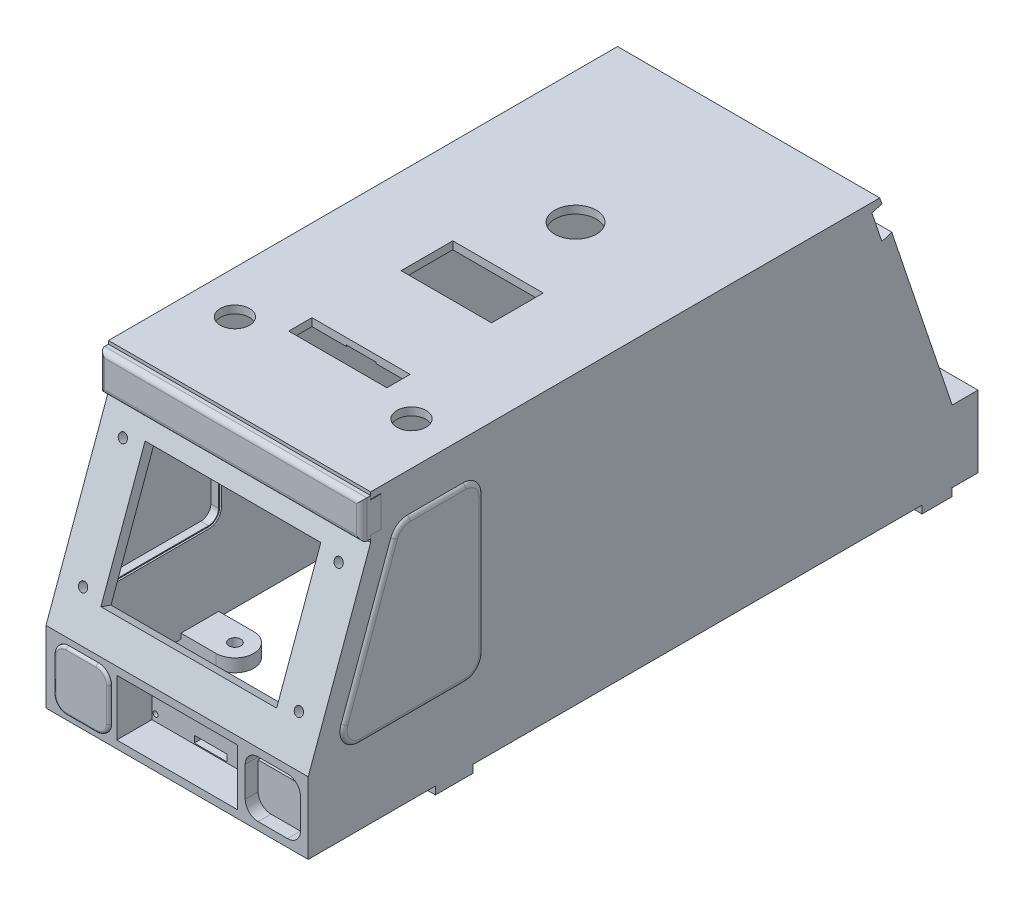
from build123d import *

# Parameters (mm, degrees)
SKETCH1_W                           = 46.7
SKETCH1_H                           = 21.7
HC_SR04_BASE_DEPTH                  = 3
SKETCH3_W                           = 52.7
SKETCH3_H                           = 27.7
SKETCH3_W_2                         = 46.7
SKETCH3_H_2                         = 21.7
HC_SR04_CONFINEMENT_DEPTH           = 16.6
SKETCH4_R                           = 0.99
SKETCH4_W                           = 12.7
SKETCH4_H                           = 2.6
HC_SR04_HOLES_DEPTH                 = 33.727740527
SKETCH5_W                           = 24.3848
SKETCH5_H                           = 27.7
HEAD_LIGHTS_BASE_DEPTH              = 3
HEAD_LIGHTS_CONFINEMENT_DEPTH       = 16.6
LCD_PANEL_BASE_DEPTH                = 101.4696
SKETCH10_W                          = 88.5
SKETCH10_H                          = 50
LCD_PANEL_RESTING_DEPTH             = 11.418897505
SKETCH11_W                          = 68
SKETCH11_H                          = 50
LCD_PANEL_VISION_DEPTH              = 98.319166783
SKETCH12_R                          = 1.7
LCD_PANEL_HOLES_DEPTH               = 98.319166783
LOGITECH_CAM_BASE_DEPTH             = 101.4696
LIDAR_BASE_DEPTH                    = 101.4696
SKETCH16_W                          = 12.5
SKETCH16_H                          = 33
SERVO_FITING_HOLE_DEPTH             = 38.48513716
SKETCH17_W                          = 12.5
SKETCH17_H                          = 22.8
SERVO_HEAD_HOLE_DEPTH               = 142.337998003
SKETCH19_R                          = 1.2
SERVO_HOLES_DEPTH                   = 142.337998003
SKETCH20_W                          = 12.5
SKETCH20_H                          = 5.1
SERVO_HOLES_DISTANCEREDUCTION_DEPTH = 3.85
SKETCH21_W                          = 91.4696
SKETCH21_H                          = 35
SERVO_ACCESS_HOLE_DEPTH             = 38.48513716
COCKPIT_BACK_DEPTH                  = 101.4696
COCKPIT_BACK_SHELL_START            = -47.7348
COCKPIT_BACK_SHELL_DEPTH            = 95.4696
SKETCH23_W                          = 93.4696
SKETCH23_H                          = 3
FRONT_BACK_MERGE_DEPTH              = 19.33513716
TRIM_REACH                          = 276.211
SKETCH24_W                          = 34.4848
SKETCH24_H                          = 45
SKETCH26_W                          = 29.4848
SKETCH26_H                          = 35
ADDITION_FROM_TRIM_DEPTH            = 3
SERVO_TRIM_REACH                    = 191.071
SKETCH27_W                          = 22.5
SKETCH27_H                          = 16.15
COCKPIT_SIDE_CLOSING_START          = -27.7
SKETCH30_W                          = 3
SKETCH30_H                          = 249.173140438
SKETCH30_W_2                        = 5
COCKPIT_SIDE_CLOSING_DEPTH          = 27.7
COCKPIT_SIDE_CLOSING_RIGHT_DEPTH    = 5
COCKPIT_SIDE_CLOSING_LEFT_DEPTH     = 5
COCKPIT_HOLES_DEPTH                 = 2
COCKPIT_HOLES_DEPTH_BACK            = 3
SKETCH44_R                          = 2.3
COCKPIT_HOLES_FILLING_DEPTH         = 10
SCREW_INSERTS_REACH                 = 274.833
SKETCH45_R                          = 2.3
SKETCH45_R_2                        = 5.65
SKETCH48_R                          = 2.3
SCREW_BACK_HOLES_DEPTH              = 5
SKETCH52_W                          = 21.3848
SKETCH52_H                          = 21.7
SKETCH52_W_2                        = 19.3848
BACKLIGHTS_BASE_DEPTH               = 5
BACKLIGHT_HOLES_REACH               = 293.021
SKETCH53_R                          = 6.15
SKETCH53_W                          = 21.3848
SKETCH53_H                          = 6
SKETCH53_W_2                        = 19.3848
FRONTLIGHTS_HOLE_REACH              = 280.978
SKETCH50_W                          = 15.3848
SKETCH50_H                          = 15.7
SKETCH50_W_2                        = 13.3848
MASSREDUCTION1_START                = -19.335137
SKETCH55_W                          = 91.4696
SKETCH55_H                          = 35.341831122
MASSREDUCTION1_DEPTH                = 19.335137
SKETCH61_W                          = 101.4696
SKETCH61_H                          = 12
FRONT_LED_RACK_DEPTH                = 4
SKETCH62_W                          = 101.4696
SKETCH62_H                          = 12
BACK_LED_RACK_DEPTH                 = 4
SKETCH63_W                          = 95.4696
SKETCH63_H                          = 0.342761735
BACK_FILLING1_DEPTH                 = 4.1098593
BACK_FILLING2_REACH                 = 275.965
SKETCH64_W                          = 95.4696
SKETCH64_H                          = 4.1098593
SKETCH68_W                          = 91.4696
SKETCH68_H                          = 65
CUT_EXTRUDE16_DEPTH                 = 11.418897505
CUT_EXTRUDE17_START                 = -45.7348
CUT_EXTRUDE17_DEPTH                 = 91.4696
SKETCH71_W                          = 21.3848
SKETCH71_H                          = 21.7
SKETCH71_W_2                        = 19.3848
BOSS_EXTRUDE2_DEPTH                 = 16.6
CUT_EXTRUDE18_REACH                 = 268.24
SKETCH72_W                          = 11.4696
SKETCH72_H                          = 12
SKETCH81_W                          = 11.1
SKETCH81_H                          = 11.1
BOSS_EXTRUDE5_DEPTH                 = 5
CUT_EXTRUDE21_DEPTH                 = 290.976855848
CUT_EXTRUDE22_DEPTH                 = 2
CUT_EXTRUDE23_DEPTH                 = 2
CUT_EXTRUDE24_REACH                 = 274.833
SKETCH87_W                          = 38
SKETCH87_H                          = 9
CUT_EXTRUDE25_REACH                 = 233.566
SKETCH88_W                          = 54.953192282
SKETCH88_H                          = 25.509171177
BOSS_EXTRUDE6_REACH                 = 271.795
SKETCH89_W                          = 35
SKETCH89_H                          = 3
CUT_EXTRUDE26_REACH                 = 274.833
SKETCH90_W                          = 35
SKETCH90_H                          = 20
CUT_EXTRUDE27_REACH                 = 274.833
SKETCH91_R                          = 8.07
SKETCH92_W                          = 21.3848
SKETCH92_H                          = 21.7
SKETCH92_W_2                        = 19.3848
CUT_EXTRUDE28_DEPTH                 = 5
CUT_EXTRUDE29_REACH                 = 283.434
SKETCH93_W                          = 21.3848
SKETCH93_H                          = 6
SKETCH93_W_2                        = 19.3848
FILLET1_R                           = 5
BOSS_EXTRUDE7_REACH                 = 267.977
SKETCH94_W                          = 95.4696
SKETCH94_H                          = 3.1098593
CUT_EXTRUDE31_START                 = -5.7348
CUT_EXTRUDE31_DEPTH                 = 11.4696
FILLET2_R                           = 5
BOSS_EXTRUDE8_DEPTH                 = 1
SKETCH98_W                          = 21.5
SKETCH98_H                          = 23
BOSS_EXTRUDE9_DEPTH                 = 1
SHELL5_START                        = 15.6
SHELL5_DEPTH                        = 1.5
FILLET3_R                           = 5
FILLET4_R                           = 1
BOSS_EXTRUDE10_DEPTH                = 101.4696
SKETCH102_W                         = 97.4696
SKETCH102_H                         = 11.8
CUT_EXTRUDE32_DEPTH                 = 7
FILLET5_R                           = 2
BOSS_EXTRUDE11_DEPTH                = 3
BOSS_EXTRUDE12_DEPTH                = 1
FILLET6_R                           = 2
FILLET11_R                          = 1


with BuildPart() as part:
    # Sketch1 → HC-SR04_Base (new body)
    with BuildSketch(Plane.XY):
        Rectangle(SKETCH1_W, SKETCH1_H)
    extrude(amount=HC_SR04_BASE_DEPTH)

    # Sketch3 → HC-SR04_Confinement (add)
    with BuildSketch(Plane(origin=(0, 0, 0), x_dir=(-1, 0, 0), z_dir=(0, 0, -1))):
        Rectangle(SKETCH3_W, SKETCH3_H)
        Rectangle(SKETCH3_W_2, SKETCH3_H_2, mode=Mode.SUBTRACT)
    extrude(amount=-HC_SR04_CONFINEMENT_DEPTH)

    # Sketch4 → HC-SR04_Holes (cut, through all)
    with BuildSketch(Plane.XY.offset(3)):
        with Locations((-21.95, 9.45)):
            Circle(SKETCH4_R)
        with Locations((-21.95, -8.25)):
            Circle(SKETCH4_R)
        with Locations((20.75, -8.25)):
            Circle(SKETCH4_R)
        with Locations((20.75, 9.45)):
            Circle(SKETCH4_R)
        with Locations((-0.6, -9.15)):
            Rectangle(SKETCH4_W, SKETCH4_H)
    extrude(amount=-HC_SR04_HOLES_DEPTH, mode=Mode.SUBTRACT)

    # Sketch5 → Head-lights_Base (add)
    with BuildSketch(Plane.XY):
        with Locations((-38.5424, 0)):
            Rectangle(SKETCH5_W, SKETCH5_H)
        with Locations((38.5424, 0)):
            Rectangle(SKETCH5_W, SKETCH5_H)
    extrude(amount=HEAD_LIGHTS_BASE_DEPTH)

    # Sketch7 → Head-lights_Confinement (add)
    with BuildSketch(Plane(origin=(0, 0, 0), x_dir=(-1, 0, 0), z_dir=(0, 0, -1))):
        Polygon((26.35, -13.85), (26.35, -10.85), (29.35, -10.85), (47.7348, -10.85), (47.7348, 10.85), (29.35, 10.85), (26.35, 10.85), (26.35, 13.85), (50.7348, 13.85), (50.7348, -13.85), align=None)
        Polygon((-50.7348, -13.85), (-50.7348, 13.85), (-26.35, 13.85), (-26.35, 10.85), (-29.35, 10.85), (-47.7348, 10.85), (-47.7348, -10.85), (-29.35, -10.85), (-26.35, -10.85), (-26.35, -13.85), align=None)
    extrude(amount=-HEAD_LIGHTS_CONFINEMENT_DEPTH)

    # Sketch8 → LCD-Panel_Base (add)
    with BuildSketch(Plane(origin=(50.7348, 0, 0), x_dir=(0, 0, -1), z_dir=(1, 0, 0))):
        Polygon((-16.6, 13.85), (0, 13.85), (22.231309316, 74.930020351), (7.573140438, 80.265157511), align=None)
    extrude(amount=-LCD_PANEL_BASE_DEPTH)

    # Sketch10 → LCD-Panel_Resting (cut)
    with BuildSketch(Plane(origin=(0, 1.620142231, 4.451304197), x_dir=(-1, 0, 0), z_dir=(0, -0.3420201433256657, -0.9396926207859095))):
        with Locations((0, 45.514742798)):
            Rectangle(SKETCH10_W, SKETCH10_H)
    extrude(amount=-LCD_PANEL_RESTING_DEPTH, mode=Mode.SUBTRACT)

    # Sketch11 → LCD-Panel_Vision (cut, through all)
    with BuildSketch(Plane(origin=(0, 1.620142231, 4.451304197), x_dir=(-1, 0, 0), z_dir=(0, -0.3420201433256657, -0.9396926207859095))):
        with Locations((0, 45.514742798)):
            Rectangle(SKETCH11_W, SKETCH11_H)
    extrude(amount=-LCD_PANEL_VISION_DEPTH, mode=Mode.SUBTRACT)

    # Sketch12 → LCD-Panel_Holes (cut, through all)
    with BuildSketch(Plane(origin=(0, 1.620142231, 4.451304197), x_dir=(-1, 0, 0), z_dir=(0, -0.3420201433256657, -0.9396926207859095))):
        with Locations(Location((-41.75, 23.014742798, 0), (0, 0, 90))):
            Circle(SKETCH12_R)
        with Locations(Location((-41.75, 68.014742798, 0), (0, 0, 90))):
            Circle(SKETCH12_R)
        with Locations(Location((41.75, 68.014742798, 0), (0, 0, 90))):
            Circle(SKETCH12_R)
        with Locations(Location((41.75, 23.014742798, 0), (0, 0, 90))):
            Circle(SKETCH12_R)
    extrude(amount=-LCD_PANEL_HOLES_DEPTH, mode=Mode.SUBTRACT)

    # Sketch13 → Logitech-Cam_Base (add)
    with BuildSketch(Plane(origin=(50.7348, 0, 0), x_dir=(0, 0, -1), z_dir=(1, 0, 0))):
        Polygon((22.231309316, 74.930020351), (52.573140438, 74.930020351), (52.573140438, 80.265157511), (52.573140438, 97.265157511), (7.573140438, 97.265157511), (7.573140438, 80.265157511), align=None)
    extrude(amount=-LOGITECH_CAM_BASE_DEPTH)

    # Sketch15 → Lidar_Base (add)
    with BuildSketch(Plane(origin=(50.7348, 0, 0), x_dir=(0, 0, -1), z_dir=(1, 0, 0))):
        Polygon((52.573140438, 97.265157511), (52.573140438, 122.265157511), (97.573140438, 122.265157511), (97.573140438, 74.930020351), (52.573140438, 74.930020351), align=None)
    extrude(amount=-LIDAR_BASE_DEPTH)

    # Sketch16 → Servo_Fiting_Hole (cut)
    with BuildSketch(Plane.XZ.offset(-74.930020351)):
        with Locations((0, -75.073140438)):
            Rectangle(SKETCH16_W, SKETCH16_H)
    extrude(amount=-SERVO_FITING_HOLE_DEPTH, mode=Mode.SUBTRACT)

    # Sketch17 → Servo_Head_Hole (cut, through all)
    with BuildSketch(Plane.XZ.offset(-74.930020351)):
        with Locations((0, -75.073140438)):
            Rectangle(SKETCH17_W, SKETCH17_H)
    extrude(amount=-SERVO_HEAD_HOLE_DEPTH, mode=Mode.SUBTRACT)

    # Sketch19 → Servo_Holes (cut, through all)
    with BuildSketch(Plane.XZ.offset(-74.930020351)):
        with Locations(Location((0, -60.923140438, 0), (0, 0, 270))):
            Circle(SKETCH19_R)
        with Locations(Location((0, -89.223140438, 0), (0, 0, 270))):
            Circle(SKETCH19_R)
    extrude(amount=-SERVO_HOLES_DEPTH, mode=Mode.SUBTRACT)

    # Sketch20 → Servo_Holes_DistanceReduction (cut)
    with BuildSketch(Plane(origin=(0, 122.265157511, 0), x_dir=(1, 0, 0), z_dir=(0, 1, 0))):
        with Locations((0, 61.123140438)):
            Rectangle(SKETCH20_W, SKETCH20_H)
        with Locations((0, 89.023140438)):
            Rectangle(SKETCH20_W, SKETCH20_H)
    extrude(amount=-SERVO_HOLES_DISTANCEREDUCTION_DEPTH, mode=Mode.SUBTRACT)

    # Sketch21 → Servo_Access_Hole (cut)
    with BuildSketch(Plane.XZ.offset(-74.930020351)):
        with Locations((0, -75.073140438)):
            Rectangle(SKETCH21_W, SKETCH21_H)
    extrude(amount=-SERVO_ACCESS_HOLE_DEPTH, mode=Mode.SUBTRACT)

    # Sketch22 → Cockpit-Back (add)
    with BuildSketch(Plane(origin=(50.7348, 0, 0), x_dir=(0, 0, -1), z_dir=(1, 0, 0))):
        Polygon((97.573140438, 97.265157511), (204.562849888, 97.265157511), (232.573140438, 13.85), (232.573140438, -13.85), (225.073140438, -13.85), (225.073140438, 13.85), (204.562849888, 74.930020351), (97.573140438, 74.930020351), align=None)
    extrude(amount=-COCKPIT_BACK_DEPTH)

    # Cockpit-Back-Shell: read off the stored shape, not the designer's step
    # Cockpit-Back-Shell outline → Cockpit-Back-Shell (cut)
    with BuildSketch(Plane.YZ.offset(COCKPIT_BACK_SHELL_START)):
        Polygon((14.340240139, -228.073140438), (-10.85, -228.073140438), (-10.85, -229.573140438), (13.359759861, -229.573140438), (94.265157511, -202.405611624), (94.265157511, -95.573140438), (74.930020351, -95.573140438), (74.930020351, -207.727469475), align=None)
    extrude(amount=COCKPIT_BACK_SHELL_DEPTH, mode=Mode.SUBTRACT)

    # Sketch23 → Front-Back-Merge (cut)
    with BuildSketch(Plane.XZ.offset(-74.930020351)):
        with Locations((1, -94.073140438)):
            Rectangle(SKETCH23_W, SKETCH23_H)
    extrude(amount=-FRONT_BACK_MERGE_DEPTH, mode=Mode.SUBTRACT)

    # Trim: up to this face of the body (flat: up to its plane)
    trim_end = Plane(part.part.faces().sort_by_distance((0, 97.265157511, -30.073140438))[0])
    # Sketch24 → Trim (cut, up to the picked face)
    with BuildSketch(Plane(origin=(0, 122.265157511, 0), x_dir=(1, 0, 0), z_dir=(0, 1, 0)), mode=Mode.PRIVATE) as trim_sk1:
        with Locations((33.4924, 75.073140438)):
            Rectangle(SKETCH24_W, SKETCH24_H)
    trim_tool1 = split(extrude(trim_sk1.sketch, amount=-TRIM_REACH, mode=Mode.PRIVATE), bisect_by=trim_end, keep=Keep.BOTH, mode=Mode.PRIVATE)
    # Sketch24 → Trim (cut, up to the picked face)
    with BuildSketch(Plane(origin=(0, 122.265157511, 0), x_dir=(1, 0, 0), z_dir=(0, 1, 0)), mode=Mode.PRIVATE) as trim_sk2:
        with Locations((-33.4924, 75.073140438)):
            Rectangle(SKETCH24_W, SKETCH24_H)
    trim_tool2 = split(extrude(trim_sk2.sketch, amount=-TRIM_REACH, mode=Mode.PRIVATE), bisect_by=trim_end, keep=Keep.BOTH, mode=Mode.PRIVATE)
    add(trim_tool1.solids().sort_by(Axis((33.4924, 122.265158, -75.07314), (0, -1, 0)))[0], mode=Mode.SUBTRACT)
    add(trim_tool2.solids().sort_by(Axis((-33.4924, 122.265158, -75.07314), (0, -1, 0)))[0], mode=Mode.SUBTRACT)

    # Sketch26 → Addition-From-Trim (add)
    with BuildSketch(Plane.XZ.offset(-94.265157511)):
        with Locations((-30.9924, -75.073140438)):
            Rectangle(SKETCH26_W, SKETCH26_H)
        with Locations((30.9924, -75.073140438)):
            Rectangle(SKETCH26_W, SKETCH26_H)
    extrude(amount=-ADDITION_FROM_TRIM_DEPTH)

    # Servo-Trim: up to this face of the body (flat: up to its plane)
    servo_trim_end = Plane(part.part.faces().sort_by_distance((0, 109.765157511, -52.573140438))[0])
    # Sketch27 → Servo-Trim (cut, up to the picked face)
    with BuildSketch(Plane(origin=(0, 0, -97.573140438), x_dir=(-1, 0, 0), z_dir=(0, 0, -1)), mode=Mode.PRIVATE) as servo_trim_sk1:
        with Locations((0, 105.340157511)):
            Rectangle(SKETCH27_W, SKETCH27_H)
    servo_trim_tool1 = split(extrude(servo_trim_sk1.sketch, amount=-SERVO_TRIM_REACH, mode=Mode.PRIVATE), bisect_by=servo_trim_end, keep=Keep.BOTH, mode=Mode.PRIVATE)
    add(servo_trim_tool1.solids().sort_by(Axis((0, 105.340158, -97.57314), (0, 0, 1)))[0], mode=Mode.SUBTRACT)

    # Sketch30 → Cockpit-Side-Closing (add)
    with BuildSketch(Plane.XZ.offset(13.85).offset(COCKPIT_SIDE_CLOSING_START)):
        with Locations((49.2348, -107.986570219)):
            Rectangle(SKETCH30_W, SKETCH30_H)
        with Locations((-48.2348, -107.986570219)):
            Rectangle(SKETCH30_W_2, SKETCH30_H)
    extrude(amount=COCKPIT_SIDE_CLOSING_DEPTH)

    # Sketch31 → Cockpit-Side-Closing-Right (add)
    with BuildSketch(Plane(origin=(50.7348, 0, 0), x_dir=(0, 0, -1), z_dir=(1, 0, 0))):
        Polygon((225.073140438, 13.85), (0, 13.85), (22.231309316, 74.930020351), (204.562849888, 74.930020351), align=None)
    extrude(amount=-COCKPIT_SIDE_CLOSING_RIGHT_DEPTH)

    # Sketch32 → Cockpit-Side-Closing-Left (add)
    with BuildSketch(Plane.ZY.offset(50.7348)):
        Polygon((0, 13.85), (-225.073140438, 13.85), (-204.562849888, 74.930020351), (-22.231309316, 74.930020351), align=None)
    extrude(amount=-COCKPIT_SIDE_CLOSING_LEFT_DEPTH)

    # Sketch44 → Cockpit_Holes (add, two sides: drawn at the far end of the back side and taken through both)
    # profile 1 of 4: a face of its own
    with BuildSketch(Plane(origin=(0, -13.85, 0), x_dir=(1, 0, 0), z_dir=(0, 1, 0)).offset(-COCKPIT_HOLES_DEPTH_BACK)):
        with BuildLine():
            Line((-34.1648, 47.223140438), (-50.7348, 47.223140438))
            Line((-50.7348, 47.223140438), (-50.7348, 32.623140438))
            Line((-50.7348, 32.623140438), (-34.1648, 32.623140438))
            ThreePointArc((-34.1648, 32.623140438), (-26.8648, 39.923140438), (-34.1648, 47.223140438))
        make_face()
        with Locations(Location((-34.1648, 39.923140438, 0), (0, 0, 270))):
            Circle(SKETCH44_R, mode=Mode.SUBTRACT)
    # profile 2 of 4: a face of its own
    with BuildSketch(Plane(origin=(0, -13.85, 0), x_dir=(1, 0, 0), z_dir=(0, 1, 0)).offset(-COCKPIT_HOLES_DEPTH_BACK)):
        with BuildLine():
            Line((34.1648, 47.223140438), (50.7348, 47.223140438))
            Line((50.7348, 47.223140438), (50.7348, 32.623140438))
            Line((50.7348, 32.623140438), (34.1648, 32.623140438))
            ThreePointArc((34.1648, 32.623140438), (26.8648, 39.923140438), (34.1648, 47.223140438))
        make_face()
        with Locations(Location((34.1648, 39.923140438, 0), (0, 0, 270))):
            Circle(SKETCH44_R, mode=Mode.SUBTRACT)
    # profile 3 of 4: a face of its own
    with BuildSketch(Plane(origin=(0, -13.85, 0), x_dir=(1, 0, 0), z_dir=(0, 1, 0)).offset(-COCKPIT_HOLES_DEPTH_BACK)):
        with BuildLine():
            Line((-31.3848, 220.933140438), (-50.7348, 220.933140438))
            Line((-50.7348, 220.933140438), (-50.7348, 232.573140438))
            Line((-50.7348, 232.573140438), (-31.3848, 232.573140438))
            ThreePointArc((-31.3848, 232.573140438), (-25.5648, 226.753140438), (-31.3848, 220.933140438))
        make_face()
        with Locations(Location((-31.3848, 226.753140438, 0), (0, 0, 270))):
            Circle(SKETCH44_R, mode=Mode.SUBTRACT)
    # profile 4 of 4: a face of its own
    with BuildSketch(Plane(origin=(0, -13.85, 0), x_dir=(1, 0, 0), z_dir=(0, 1, 0)).offset(-COCKPIT_HOLES_DEPTH_BACK)):
        with BuildLine():
            Line((31.3952, 232.573140438), (50.7348, 232.573140438))
            Line((50.7348, 232.573140438), (50.7348, 220.933140438))
            Line((50.7348, 220.933140438), (31.3952, 220.933140438))
            ThreePointArc((31.3952, 220.933140438), (25.5752, 226.753140438), (31.3952, 232.573140438))
        make_face()
        with Locations(Location((31.3952, 226.753140438, 0), (0, 0, 270))):
            Circle(SKETCH44_R, mode=Mode.SUBTRACT)
    extrude(amount=COCKPIT_HOLES_DEPTH + COCKPIT_HOLES_DEPTH_BACK)

    # Sketch47 → Cockpit-Holes-Filling (add)
    with BuildSketch(Plane(origin=(0, 0, -232.573140438), x_dir=(-1, 0, 0), z_dir=(0, 0, -1))):
        Polygon((-50.7348, 13.85), (-15.7348, 13.85), (15.7348, 13.85), (50.7348, 13.85), (50.7348, -13.85), (15.7348, -13.85), (-15.7348, -13.85), (-50.7348, -13.85), align=None)
    extrude(amount=COCKPIT_HOLES_FILLING_DEPTH)

    # Screw -Inserts: up to this face of the body (flat: up to its plane)
    screw_inserts_end = Plane(part.part.faces().sort_by_distance((38.255559, -11.85, -39.923140438))[0])
    # Sketch45 → Screw -Inserts (cut, up to the picked face)
    with BuildSketch(Plane(origin=(0, 97.265157511, 0), x_dir=(1, 0, 0), z_dir=(0, 1, 0)), mode=Mode.PRIVATE) as screw_inserts_sk1:
        with Locations(Location((31.3952, 226.753140438, 0), (0, 0, 270))):
            Circle(SKETCH45_R)
    screw_inserts_tool1 = split(extrude(screw_inserts_sk1.sketch, amount=-SCREW_INSERTS_REACH, mode=Mode.PRIVATE), bisect_by=screw_inserts_end, keep=Keep.BOTH, mode=Mode.PRIVATE)
    # Sketch45 → Screw -Inserts (cut, up to the picked face)
    with BuildSketch(Plane(origin=(0, 97.265157511, 0), x_dir=(1, 0, 0), z_dir=(0, 1, 0)), mode=Mode.PRIVATE) as screw_inserts_sk2:
        with Locations(Location((-34.1648, 39.923140438, 0), (0, 0, 270))):
            Circle(SKETCH45_R)
    screw_inserts_tool2 = split(extrude(screw_inserts_sk2.sketch, amount=-SCREW_INSERTS_REACH, mode=Mode.PRIVATE), bisect_by=screw_inserts_end, keep=Keep.BOTH, mode=Mode.PRIVATE)
    # Sketch45 → Screw -Inserts (cut, up to the picked face)
    with BuildSketch(Plane(origin=(0, 97.265157511, 0), x_dir=(1, 0, 0), z_dir=(0, 1, 0)), mode=Mode.PRIVATE) as screw_inserts_sk3:
        with Locations(Location((34.1648, 39.923140438, 0), (0, 0, 270))):
            Circle(SKETCH45_R)
    screw_inserts_tool3 = split(extrude(screw_inserts_sk3.sketch, amount=-SCREW_INSERTS_REACH, mode=Mode.PRIVATE), bisect_by=screw_inserts_end, keep=Keep.BOTH, mode=Mode.PRIVATE)
    # Sketch45 → Screw -Inserts (cut, up to the picked face)
    with BuildSketch(Plane(origin=(0, 97.265157511, 0), x_dir=(1, 0, 0), z_dir=(0, 1, 0)), mode=Mode.PRIVATE) as screw_inserts_sk4:
        with Locations(Location((-34.1648, 39.923140438, 0), (0, 0, 270))):
            Circle(SKETCH45_R_2)
    screw_inserts_tool4 = split(extrude(screw_inserts_sk4.sketch, amount=-SCREW_INSERTS_REACH, mode=Mode.PRIVATE), bisect_by=screw_inserts_end, keep=Keep.BOTH, mode=Mode.PRIVATE)
    # Sketch45 → Screw -Inserts (cut, up to the picked face)
    with BuildSketch(Plane(origin=(0, 97.265157511, 0), x_dir=(1, 0, 0), z_dir=(0, 1, 0)), mode=Mode.PRIVATE) as screw_inserts_sk5:
        with Locations(Location((34.1648, 39.923140438, 0), (0, 0, 270))):
            Circle(SKETCH45_R_2)
    screw_inserts_tool5 = split(extrude(screw_inserts_sk5.sketch, amount=-SCREW_INSERTS_REACH, mode=Mode.PRIVATE), bisect_by=screw_inserts_end, keep=Keep.BOTH, mode=Mode.PRIVATE)
    # Sketch45 → Screw -Inserts (cut, up to the picked face)
    with BuildSketch(Plane(origin=(0, 97.265157511, 0), x_dir=(1, 0, 0), z_dir=(0, 1, 0)), mode=Mode.PRIVATE) as screw_inserts_sk6:
        with Locations(Location((-31.3848, 226.753140438, 0), (0, 0, 270))):
            Circle(SKETCH45_R_2)
    screw_inserts_tool6 = split(extrude(screw_inserts_sk6.sketch, amount=-SCREW_INSERTS_REACH, mode=Mode.PRIVATE), bisect_by=screw_inserts_end, keep=Keep.BOTH, mode=Mode.PRIVATE)
    # Sketch45 → Screw -Inserts (cut, up to the picked face)
    with BuildSketch(Plane(origin=(0, 97.265157511, 0), x_dir=(1, 0, 0), z_dir=(0, 1, 0)), mode=Mode.PRIVATE) as screw_inserts_sk7:
        with Locations(Location((31.3952, 226.753140438, 0), (0, 0, 270))):
            Circle(SKETCH45_R_2)
    screw_inserts_tool7 = split(extrude(screw_inserts_sk7.sketch, amount=-SCREW_INSERTS_REACH, mode=Mode.PRIVATE), bisect_by=screw_inserts_end, keep=Keep.BOTH, mode=Mode.PRIVATE)
    # Sketch45 → Screw -Inserts (cut, up to the picked face)
    with BuildSketch(Plane(origin=(0, 97.265157511, 0), x_dir=(1, 0, 0), z_dir=(0, 1, 0)), mode=Mode.PRIVATE) as screw_inserts_sk8:
        with Locations(Location((-31.3848, 226.753140438, 0), (0, 0, 270))):
            Circle(SKETCH45_R)
    screw_inserts_tool8 = split(extrude(screw_inserts_sk8.sketch, amount=-SCREW_INSERTS_REACH, mode=Mode.PRIVATE), bisect_by=screw_inserts_end, keep=Keep.BOTH, mode=Mode.PRIVATE)
    add(screw_inserts_tool1.solids().sort_by(Axis((31.3952, 97.265158, -226.75314), (0, -1, 0)))[0], mode=Mode.SUBTRACT)
    add(screw_inserts_tool2.solids().sort_by(Axis((-34.1648, 97.265158, -39.92314), (0, -1, 0)))[0], mode=Mode.SUBTRACT)
    add(screw_inserts_tool3.solids().sort_by(Axis((34.1648, 97.265158, -39.92314), (0, -1, 0)))[0], mode=Mode.SUBTRACT)
    add(screw_inserts_tool4.solids().sort_by(Axis((-34.1648, 97.265158, -39.92314), (0, -1, 0)))[0], mode=Mode.SUBTRACT)
    add(screw_inserts_tool5.solids().sort_by(Axis((34.1648, 97.265158, -39.92314), (0, -1, 0)))[0], mode=Mode.SUBTRACT)
    add(screw_inserts_tool6.solids().sort_by(Axis((-31.3848, 97.265158, -226.75314), (0, -1, 0)))[0], mode=Mode.SUBTRACT)
    add(screw_inserts_tool7.solids().sort_by(Axis((31.3952, 97.265158, -226.75314), (0, -1, 0)))[0], mode=Mode.SUBTRACT)
    add(screw_inserts_tool8.solids().sort_by(Axis((-31.3848, 97.265158, -226.75314), (0, -1, 0)))[0], mode=Mode.SUBTRACT)

    # Sketch48 → Screw-Back-Holes (cut)
    with BuildSketch(Plane.XZ.offset(16.85)):
        with Locations(Location((-31.3848, -226.753140438, 0), (0, 0, 90))):
            Circle(SKETCH48_R)
        with Locations(Location((31.3952, -226.753140438, 0), (0, 0, 90))):
            Circle(SKETCH48_R)
    extrude(amount=-SCREW_BACK_HOLES_DEPTH, mode=Mode.SUBTRACT)

    # Sketch52 → BackLights_Base (cut)
    with BuildSketch(Plane(origin=(0, 0, -242.573140438), x_dir=(-1, 0, 0), z_dir=(0, 0, -1))):
        with Locations((-37.0424, 0)):
            Rectangle(SKETCH52_W, SKETCH52_H)
        with Locations((36.0424, 0)):
            Rectangle(SKETCH52_W_2, SKETCH52_H)
    extrude(amount=-BACKLIGHTS_BASE_DEPTH, mode=Mode.SUBTRACT)

    # Sketch53 → BackLight_Holes (cut, up to next)
    with BuildSketch(Plane(origin=(0, 0, -242.573140438), x_dir=(-1, 0, 0), z_dir=(0, 0, -1)), mode=Mode.PRIVATE) as backlight_holes_sk1:
        Circle(SKETCH53_R)
    backlight_holes_tool1 = extrude(backlight_holes_sk1.sketch, amount=-BACKLIGHT_HOLES_REACH, mode=Mode.PRIVATE) & part.part
    # Sketch53 → BackLight_Holes (cut, up to next)
    with BuildSketch(Plane(origin=(0, 0, -242.573140438), x_dir=(-1, 0, 0), z_dir=(0, 0, -1)), mode=Mode.PRIVATE) as backlight_holes_sk2:
        with Locations((-37.0424, 7.85)):
            Rectangle(SKETCH53_W, SKETCH53_H)
    backlight_holes_tool2 = extrude(backlight_holes_sk2.sketch, amount=-BACKLIGHT_HOLES_REACH, mode=Mode.PRIVATE) & part.part
    # Sketch53 → BackLight_Holes (cut, up to next)
    with BuildSketch(Plane(origin=(0, 0, -242.573140438), x_dir=(-1, 0, 0), z_dir=(0, 0, -1)), mode=Mode.PRIVATE) as backlight_holes_sk3:
        with Locations((36.0424, 7.85)):
            Rectangle(SKETCH53_W_2, SKETCH53_H)
    backlight_holes_tool3 = extrude(backlight_holes_sk3.sketch, amount=-BACKLIGHT_HOLES_REACH, mode=Mode.PRIVATE) & part.part
    add(backlight_holes_tool1.solids().sort_by_distance((0, 0, -242.57314))[0], mode=Mode.SUBTRACT)
    add(backlight_holes_tool2.solids().sort_by_distance((37.0424, 7.85, -242.57314))[0], mode=Mode.SUBTRACT)
    add(backlight_holes_tool3.solids().sort_by_distance((-36.0424, 7.85, -242.57314))[0], mode=Mode.SUBTRACT)

    # Sketch50 → FrontLights_Hole (cut, up to next)
    with BuildSketch(Plane.XY.offset(3), mode=Mode.PRIVATE) as frontlights_hole_sk1:
        with Locations((37.0424, 0)):
            Rectangle(SKETCH50_W, SKETCH50_H)
    frontlights_hole_tool1 = extrude(frontlights_hole_sk1.sketch, amount=-FRONTLIGHTS_HOLE_REACH, mode=Mode.PRIVATE) & part.part
    # Sketch50 → FrontLights_Hole (cut, up to next)
    with BuildSketch(Plane.XY.offset(3), mode=Mode.PRIVATE) as frontlights_hole_sk2:
        with Locations((-36.0424, 0)):
            Rectangle(SKETCH50_W_2, SKETCH50_H)
    frontlights_hole_tool2 = extrude(frontlights_hole_sk2.sketch, amount=-FRONTLIGHTS_HOLE_REACH, mode=Mode.PRIVATE) & part.part
    add(frontlights_hole_tool1.solids().sort_by_distance((37.0424, 0, 3))[0], mode=Mode.SUBTRACT)
    add(frontlights_hole_tool2.solids().sort_by_distance((-36.0424, 0, 3))[0], mode=Mode.SUBTRACT)

    # Sketch55 → MassReduction1 (cut)
    with BuildSketch(Plane.XZ.offset(-74.930020351).offset(MASSREDUCTION1_START)):
        with Locations((0, -39.902224877)):
            Rectangle(SKETCH55_W, SKETCH55_H)
    extrude(amount=MASSREDUCTION1_DEPTH, mode=Mode.SUBTRACT)

    # Sketch61 → Front-LED-rack (cut)
    with BuildSketch(Plane.XY.offset(-7.573140438)):
        with Locations((0, 88.765157511)):
            Rectangle(SKETCH61_W, SKETCH61_H)
    extrude(amount=-FRONT_LED_RACK_DEPTH, mode=Mode.SUBTRACT)

    # Sketch62 → Back-LED-Rack (cut)
    with BuildSketch(Plane(origin=(0, 71.586402538, -213.185615933), x_dir=(-1, 0, 0), z_dir=(0, 0.3183261982820336, -0.9479812400503016))):
        with Locations((0, 18.587830317)):
            Rectangle(SKETCH62_W, SKETCH62_H)
    extrude(amount=-BACK_LED_RACK_DEPTH, mode=Mode.SUBTRACT)

    # Sketch63 → Back-Filling1 (add)
    with BuildSketch(Plane(origin=(0, 70.631423943, -210.341672213), x_dir=(1, 0, 0), z_dir=(0, -0.3183261982820336, 0.9479812400503016))):
        with Locations((0, 24.759211185)):
            Rectangle(SKETCH63_W, SKETCH63_H)
    extrude(amount=BACK_FILLING1_DEPTH)

    # Sketch64 → Back-Filling2 (add, up to next)
    with BuildSketch(Plane(origin=(0, 23.633733569, 7.936060589), x_dir=(1, 0, 0), z_dir=(0, 0.9479812400503016, 0.3183261982820337)), mode=Mode.PRIVATE) as back_filling2_sk1:
        with Locations((0, 219.828862271)):
            Rectangle(SKETCH64_W, SKETCH64_H)
    back_filling2_tool1 = extrude(back_filling2_sk1.sketch, amount=BACK_FILLING2_REACH, mode=Mode.PRIVATE) - part.part
    add(back_filling2_tool1.solids().sort_by_distance((0, 93.61102, -200.457577))[0])

    # Sketch68 → Cut-Extrude16 (cut)
    with BuildSketch(Plane(origin=(0, 1.620142231, 4.451304197), x_dir=(-1, 0, 0), z_dir=(0, -0.3420201433256658, -0.9396926207859095))):
        with Locations((0, 45.514742798)):
            Rectangle(SKETCH68_W, SKETCH68_H)
    extrude(amount=-CUT_EXTRUDE16_DEPTH, mode=Mode.SUBTRACT)

    # Cut-Extrude17: read off the stored shape, not the designer's step
    # Cut-Extrude17 outline → Cut-Extrude17 (cut)
    with BuildSketch(Plane.YZ.offset(CUT_EXTRUDE17_START)):
        Polygon((94.265157511, -22.231309316), (94.265157511, -17.116986807), (78.835513312, -11.501055593), (74.930020351, -22.231309316), align=None)
    extrude(amount=CUT_EXTRUDE17_DEPTH, mode=Mode.SUBTRACT)

    # Sketch71 → Boss-Extrude2 (add)
    with BuildSketch(Plane.XY.offset(16.6)):
        with Locations((37.0424, 0)):
            Rectangle(SKETCH71_W, SKETCH71_H)
        with Locations((-36.0424, 0)):
            Rectangle(SKETCH71_W_2, SKETCH71_H)
    extrude(amount=-BOSS_EXTRUDE2_DEPTH)

    # Sketch72 → Cut-Extrude18 (cut, up to next)
    with BuildSketch(Plane.XY.offset(-11.573140438), mode=Mode.PRIVATE) as cut_extrude18_sk1:
        with Locations((0, 88.765157511)):
            Rectangle(SKETCH72_W, SKETCH72_H)
    cut_extrude18_tool1 = extrude(cut_extrude18_sk1.sketch, amount=-CUT_EXTRUDE18_REACH, mode=Mode.PRIVATE) & part.part
    add(cut_extrude18_tool1.solids().sort_by_distance((0, 88.765158, -11.57314))[0], mode=Mode.SUBTRACT)

    # Sketch81 → Boss-Extrude5 (add)
    with BuildSketch(Plane(origin=(0, 97.265157511, 0), x_dir=(1, 0, 0), z_dir=(0, 1, 0))):
        with Locations((-21.8, 58.123140438)):
            Rectangle(SKETCH81_W, SKETCH81_H)
        with Locations((-21.8, 92.023140438)):
            Rectangle(SKETCH81_W, SKETCH81_H)
        with Locations((21.8, 92.023140438)):
            Rectangle(SKETCH81_W, SKETCH81_H)
        with Locations((21.8, 58.123140438)):
            Rectangle(SKETCH81_W, SKETCH81_H)
    extrude(amount=BOSS_EXTRUDE5_DEPTH)

    # Sketch33 → Cut-Extrude21 (cut, through all)
    with BuildSketch(Plane.ZY.offset(50.7348)):
        Polygon((-48.304538666, 17.710800741), (-48.304538666, 80.51138782), (-18.304538666, 80.51138782), (4.553005725, 17.710800741), align=None)
    extrude(amount=-CUT_EXTRUDE21_DEPTH, mode=Mode.SUBTRACT)

    # Sketch85 → Cut-Extrude22 (cut)
    with BuildSketch(Plane(origin=(-45.7348, 0, 0), x_dir=(0, 0, -1), z_dir=(1, 0, 0))):
        Polygon((95.573140438, 94.265157511), (17.116986807, 94.265157511), (-10.730253723, 17.755492961), (0, 13.85), (0, -13.85), (32.623140438, -13.85), (32.623140438, -11.85), (47.223140438, -11.85), (47.223140438, -13.85), (220.933140438, -13.85), (220.933140438, -11.85), (225.073140438, -11.85), (225.073140438, 13.85), (204.562849888, 74.930020351), (95.573140438, 74.930020351), align=None)
    extrude(amount=-CUT_EXTRUDE22_DEPTH, mode=Mode.SUBTRACT)

    # Sketch86 → Cut-Extrude23 (cut)
    with BuildSketch(Plane.ZY.offset(-45.7348)):
        Polygon((0, 13.85), (10.730253723, 17.755492961), (-17.116986807, 94.265157511), (-92.573140438, 94.265157511), (-92.573140438, 74.930020351), (-204.562849888, 74.930020351), (-225.073140438, 13.85), align=None)
    extrude(amount=-CUT_EXTRUDE23_DEPTH, mode=Mode.SUBTRACT)

    # Sketch87 → Cut-Extrude24 (cut, up to next)
    with BuildSketch(Plane(origin=(0, 97.265157511, 0), x_dir=(1, 0, 0), z_dir=(0, 1, 0)), mode=Mode.PRIVATE) as cut_extrude24_sk1:
        with Locations((0, 50.073140438)):
            Rectangle(SKETCH87_W, SKETCH87_H)
    cut_extrude24_tool1 = extrude(cut_extrude24_sk1.sketch, amount=-CUT_EXTRUDE24_REACH, mode=Mode.PRIVATE) & part.part
    add(cut_extrude24_tool1.solids().sort_by_distance((0, 97.265158, -50.07314))[0], mode=Mode.SUBTRACT)

    # Sketch88 → Cut-Extrude25 (cut, up to next)
    with BuildSketch(Plane.XY.offset(-52.573140438), mode=Mode.PRIVATE) as cut_extrude25_sk1:
        with Locations((0.126596141, 110.0197431)):
            Rectangle(SKETCH88_W, SKETCH88_H)
    cut_extrude25_tool1 = extrude(cut_extrude25_sk1.sketch, amount=-CUT_EXTRUDE25_REACH, mode=Mode.PRIVATE) & part.part
    add(cut_extrude25_tool1.solids().sort_by_distance((0.126596, 110.019743, -52.57314))[0], mode=Mode.SUBTRACT)

    # Sketch89 → Boss-Extrude6 (add, up to next)
    with BuildSketch(Plane(origin=(-16.25, 0, 0), x_dir=(0, 0, -1), z_dir=(1, 0, 0)), mode=Mode.PRIVATE) as boss_extrude6_sk1:
        with Locations((75.073140438, 95.765157511)):
            Rectangle(SKETCH89_W, SKETCH89_H)
    boss_extrude6_tool1 = extrude(boss_extrude6_sk1.sketch, amount=BOSS_EXTRUDE6_REACH, mode=Mode.PRIVATE) - part.part
    add(boss_extrude6_tool1.solids().sort_by_distance((-16.25, 95.765158, -75.07314))[0])

    # Sketch90 → Cut-Extrude26 (cut, up to next)
    with BuildSketch(Plane(origin=(0, 97.265157511, 0), x_dir=(1, 0, 0), z_dir=(0, 1, 0)), mode=Mode.PRIVATE) as cut_extrude26_sk1:
        with Locations((0, 97.573140438)):
            Rectangle(SKETCH90_W, SKETCH90_H)
    cut_extrude26_tool1 = extrude(cut_extrude26_sk1.sketch, amount=-CUT_EXTRUDE26_REACH, mode=Mode.PRIVATE) & part.part
    add(cut_extrude26_tool1.solids().sort_by_distance((0, 97.265158, -97.57314))[0], mode=Mode.SUBTRACT)

    # Sketch91 → Cut-Extrude27 (cut, up to next)
    with BuildSketch(Plane(origin=(0, 97.265157511, 0), x_dir=(1, 0, 0), z_dir=(0, 1, 0)), mode=Mode.PRIVATE) as cut_extrude27_sk1:
        with Locations(Location((0, 137.573140438, 0), (0, 0, 270))):
            Circle(SKETCH91_R)
    cut_extrude27_tool1 = extrude(cut_extrude27_sk1.sketch, amount=-CUT_EXTRUDE27_REACH, mode=Mode.PRIVATE) & part.part
    add(cut_extrude27_tool1.solids().sort_by_distance((0, 97.265158, -137.57314))[0], mode=Mode.SUBTRACT)

    # Sketch92 → Cut-Extrude28 (cut)
    with BuildSketch(Plane.XY.offset(16.6)):
        with Locations((37.0424, 0)):
            Rectangle(SKETCH92_W, SKETCH92_H)
        with Locations((-36.0424, 0)):
            Rectangle(SKETCH92_W_2, SKETCH92_H)
    extrude(amount=-CUT_EXTRUDE28_DEPTH, mode=Mode.SUBTRACT)

    # Sketch93 → Cut-Extrude29 (cut, up to next)
    with BuildSketch(Plane.XY.offset(16.6), mode=Mode.PRIVATE) as cut_extrude29_sk1:
        with Locations((37.0424, 7.85)):
            Rectangle(SKETCH93_W, SKETCH93_H)
    cut_extrude29_tool1 = extrude(cut_extrude29_sk1.sketch, amount=-CUT_EXTRUDE29_REACH, mode=Mode.PRIVATE) & part.part
    # Sketch93 → Cut-Extrude29 (cut, up to next)
    with BuildSketch(Plane.XY.offset(16.6), mode=Mode.PRIVATE) as cut_extrude29_sk2:
        with Locations((-36.0424, 7.85)):
            Rectangle(SKETCH93_W_2, SKETCH93_H)
    cut_extrude29_tool2 = extrude(cut_extrude29_sk2.sketch, amount=-CUT_EXTRUDE29_REACH, mode=Mode.PRIVATE) & part.part
    add(cut_extrude29_tool1.solids().sort_by_distance((37.0424, 7.85, 16.6))[0], mode=Mode.SUBTRACT)
    add(cut_extrude29_tool2.solids().sort_by_distance((-36.0424, 7.85, 16.6))[0], mode=Mode.SUBTRACT)

    # Fillet1
    fillet1_edges = [part.edges().sort_by_distance(p)[0] for p in [
        (47.7348, 10.85, 8.3),
        (47.7348, -10.85, 14.1),
        (26.35, -10.85, 14.1),
        (26.35, 10.85, 8.3),
        (-26.35, 10.85, 8.3),
        (-26.35, -10.85, 14.1),
        (-45.7348, -10.85, 14.1),
        (-45.7348, 10.85, 8.3),
        (26.35, -10.85, -240.073140438),
        (47.7348, -10.85, -240.073140438),
        (47.7348, 10.85, -236.073140438),
        (26.35, 10.85, -236.073140438),
        (-26.35, 10.85, -236.073140438),
        (-45.7348, 10.85, -236.073140438),
        (-45.7348, -10.85, -240.073140438),
        (-26.35, -10.85, -240.073140438),
    ]]
    fillet(fillet1_edges, radius=FILLET1_R)

    # Boss-Extrude7: up to this face of the body (flat: up to its plane)
    boss_extrude7_end = Plane(part.part.faces().sort_by_distance((0, 74.930020351, -206.145159682))[0])
    # Sketch94 → Boss-Extrude7 (add, up to the picked face)
    with BuildSketch(Plane(origin=(0, 23.308801874, 7.826950549), x_dir=(1, 0, 0), z_dir=(0, -0.9479812400503016, -0.3183261982820337)), mode=Mode.PRIVATE) as boss_extrude7_sk1:
        with Locations((0, -219.328862271)):
            Rectangle(SKETCH94_W, SKETCH94_H)
    boss_extrude7_tool1 = split(extrude(boss_extrude7_sk1.sketch, amount=BOSS_EXTRUDE7_REACH, mode=Mode.PRIVATE), bisect_by=boss_extrude7_end, keep=Keep.BOTH, mode=Mode.PRIVATE)
    add(boss_extrude7_tool1.solids().sort_by(Axis((0, 93.126925, -200.092696), (0, -0.9479812400503016, -0.3183261982820337)))[0])

    # Cut-Extrude31: read off the stored shape, not the designer's step
    # Cut-Extrude31 outline → Cut-Extrude31 (cut)
    with BuildSketch(Plane.YZ.offset(CUT_EXTRUDE31_START)):
        Polygon((93.621899618, -201.566740424), (94.765157511, -201.182841541), (94.765157511, -198.07023121), (94.265157511, -198.07023121), (82.765157511, -201.931859611), (82.765157511, -205.212366829), align=None)
    extrude(amount=CUT_EXTRUDE31_DEPTH, mode=Mode.SUBTRACT)

    # Fillet2
    fillet2_edges = [part.edges().sort_by_distance(p)[0] for p in [
        (49.2348, 80.51138782, -18.304538666),
        (49.2348, 17.710800741, 4.553005725),
        (49.2348, 17.710800741, -48.304538666),
        (49.2348, 80.51138782, -48.304538666),
        (-49.2348, 80.51138782, -18.304538666),
        (-49.2348, 80.51138782, -48.304538666),
        (-49.2348, 17.710800741, -48.304538666),
        (-49.2348, 17.710800741, 4.553005725),
    ]]
    fillet(fillet2_edges, radius=FILLET2_R)


with BuildPart() as body_2:
    # Sketch97 → Boss-Extrude8 (new body)
    with BuildSketch(Plane.XY.offset(16.6)):
        with BuildLine():
            Line((-40.8348, -10.85), (-31.45, -10.85))
            ThreePointArc((-31.45, -10.85), (-27.914466094, -9.385533906), (-26.45, -5.85))
            Line((-26.45, -5.85), (-26.45, 5.85))
            ThreePointArc((-26.45, 5.85), (-27.94935699, 9.321064296), (-31.45, 10.75))
            Line((-31.45, 10.75), (-40.7348, 10.75))
            ThreePointArc((-40.7348, 10.75), (-44.23544301, 9.321064296), (-45.7348, 5.85))
            Line((-45.7348, 5.85), (-45.7348, -5.85))
            ThreePointArc((-45.7348, -5.85), (-44.305864296, -9.35064301), (-40.8348, -10.85))
        make_face()
    extrude(amount=-BOSS_EXTRUDE8_DEPTH)

    # Sketch98 → Boss-Extrude9 (add)
    with BuildSketch(Plane.XY.offset(16.6)):
        with Locations((-36.0924, 0)):
            Rectangle(SKETCH98_W, SKETCH98_H)
    extrude(amount=BOSS_EXTRUDE9_DEPTH)

    # Shell5: read off the stored shape, not the designer's step
    # Shell5 outline → Shell5 (cut)
    with BuildSketch(Plane.XY.offset(SHELL5_START)):
        with BuildLine():
            Line((-45.2348, 5.844867808), (-45.234799989, -5.85))
            ThreePointArc((-45.234799989, -5.85), (-43.950496301, -8.998903836), (-40.829667808, -10.35))
            Line((-40.829667808, -10.35), (-31.45, -10.35))
            ThreePointArc((-31.45, -10.35), (-28.268019485, -9.031980515), (-26.95, -5.85))
            Line((-26.95, -5.85), (-26.95, 5.844867808))
            ThreePointArc((-26.95, 5.844867808), (-28.301060431, 8.965661321), (-31.44989999, 10.25000001))
            Line((-31.44989999, 10.25000001), (-40.7348, 10.249999989))
            ThreePointArc((-40.7348, 10.249999989), (-43.883703836, 8.965696301), (-45.2348, 5.844867808))
        make_face()
    extrude(amount=SHELL5_DEPTH, mode=Mode.SUBTRACT)

    # Fillet3
    fillet3_edges = [body_2.edges().sort_by_distance(p)[0] for p in [
        (-25.3424, -11.5, 17.1),
        (-25.3424, 11.5, 17.1),
        (-46.8424, 11.5, 17.1),
        (-46.8424, -11.5, 17.1),
    ]]
    fillet(fillet3_edges, radius=FILLET3_R)

    # Fillet4
    fillet4_edges = [body_2.edges().sort_by_distance(p)[0] for p in [
        (-25.3424, 0, 17.6),
        (-26.806866094, -10.035533906, 17.6),
        (-36.0924, -11.5, 17.6),
        (-45.377933906, -10.035533906, 17.6),
        (-46.8424, 0, 17.6),
        (-45.377933906, 10.035533906, 17.6),
        (-26.806866094, 10.035533906, 17.6),
        (-36.0924, 11.5, 17.6),
    ]]
    fillet(fillet4_edges, radius=FILLET4_R - 0.0001)  # a hair under: the kernel refuses the full size


with BuildPart() as body_3:
    # Sketch101 → Boss-Extrude10 (new body)
    with BuildSketch(Plane.ZY.offset(50.7348)):
        Polygon((-11.573140438, 94.565157511), (-7.573140438, 94.565157511), (-7.573140438, 96.015157511), (-4.073140438, 96.015157511), (-4.073140438, 81.515157511), (-7.573140438, 81.515157511), (-7.573140438, 82.765157511), (-11.573140438, 82.765157511), align=None)
    extrude(amount=-BOSS_EXTRUDE10_DEPTH)

    # Sketch102 → Cut-Extrude32 (cut)
    with BuildSketch(Plane(origin=(0, 0, -11.573140438), x_dir=(-1, 0, 0), z_dir=(0, 0, -1))):
        with Locations((0, 88.665157511)):
            Rectangle(SKETCH102_W, SKETCH102_H)
    extrude(amount=-CUT_EXTRUDE32_DEPTH, mode=Mode.SUBTRACT)

    # Fillet5
    fillet5_edges = [body_3.edges().sort_by_distance(p)[0] for p in [
        (0, 81.515157511, -4.073140438),
        (0, 96.015157511, -4.073140438),
        (50.7348, 88.765157511, -4.073140438),
        (-50.7348, 88.765157511, -4.073140438),
    ]]
    fillet(fillet5_edges, radius=FILLET5_R)


with BuildPart() as body_4:
    # Sketch104 → Boss-Extrude11 (new body)
    with BuildSketch(Plane(origin=(50.7348, 0, 0), x_dir=(0, 0, -1), z_dir=(1, 0, 0))):
        with BuildLine():
            Line((2.587734309, 17.810800741), (43.304538666, 17.810800741))
            ThreePointArc((43.304538666, 17.810800741), (46.769361894, 19.245977513), (48.204538666, 22.710800741))
            Line((48.204538666, 22.710800741), (48.204538666, 75.51138782))
            ThreePointArc((48.204538666, 75.51138782), (46.769361894, 78.976211048), (43.304538666, 80.41138782))
            Line((43.304538666, 80.41138782), (21.805576357, 80.41138782))
            ThreePointArc((21.805576357, 80.41138782), (18.995051819, 79.525232837), (17.201082515, 77.187286522))
            Line((17.201082515, 77.187286522), (-2.016759533, 24.386699443))
            ThreePointArc((-2.016759533, 24.386699443), (-1.426110708, 19.900276203), (2.587734309, 17.810800741))
        make_face()
        with BuildLine():
            Line((2.587734309, 18.810800741), (43.304538666, 18.810800741))
            ThreePointArc((43.304538666, 18.810800741), (46.062255113, 19.953084294), (47.204538666, 22.710800741))
            Line((47.204538666, 22.710800741), (47.204538666, 75.51138782))
            ThreePointArc((47.204538666, 75.51138782), (46.062255113, 78.269104267), (43.304538666, 79.41138782))
            Line((43.304538666, 79.41138782), (21.805576357, 79.41138782))
            ThreePointArc((21.805576357, 79.41138782), (19.568628255, 78.706080793), (18.140775136, 76.845266379))
            Line((18.140775136, 76.845266379), (-1.077066913, 24.0446793))
            ThreePointArc((-1.077066913, 24.0446793), (-0.606958664, 20.473852639), (2.587734309, 18.810800741))
        make_face(mode=Mode.SUBTRACT)
    extrude(amount=-BOSS_EXTRUDE11_DEPTH)


with BuildPart() as body_5:
    # Sketch105 → Boss-Extrude12 (new body)
    with BuildSketch(Plane(origin=(50.7348, 0, 0), x_dir=(0, 0, -1), z_dir=(1, 0, 0))):
        with BuildLine():
            Line((2.587734309, 15.810800741), (43.304538666, 15.810800741))
            ThreePointArc((43.304538666, 15.810800741), (48.183575456, 17.831763951), (50.204538666, 22.710800741))
            Line((50.204538666, 22.710800741), (50.204538666, 75.51138782))
            ThreePointArc((50.204538666, 75.51138782), (48.183575456, 80.39042461), (43.304538666, 82.41138782))
            Line((43.304538666, 82.41138782), (21.805576357, 82.41138782))
            ThreePointArc((21.805576357, 82.41138782), (17.847898946, 81.163536926), (15.321697274, 77.871326809))
            Line((15.321697274, 77.871326809), (-3.896144775, 25.07073973))
            ThreePointArc((-3.896144775, 25.07073973), (-3.064414797, 18.75312333), (2.587734309, 15.810800741))
        make_face()
    extrude(amount=BOSS_EXTRUDE12_DEPTH)

    # Fillet6
    # the kernel refuses this fillet: 2 mm, written as the material it takes off along each edge
    with BuildSketch(Plane(origin=(51.7348, 77.871326809, -15.321697274), x_dir=(-1, 0, 0), z_dir=(0, -0.9396926207859094, 0.342020143325666))) as fillet6_piece_1:
        with BuildLine():
            CenterArc((2, 1.732050808), FILLET6_R, 180, 60)
            Line((0, 1.732050808), (-0.04, 1.732050808))
            Line((-0.04, 1.732050808), (-0.04, 0))
            Line((-0.04, 0), (0, -0.04))
            ThreePointArc((0, -0.04), (0.5, -0.04), (0.98, -0.034641016))
            Line((0.98, -0.034641016), (1, 0))
        make_face()
    extrude(amount=56.189211144, mode=Mode.SUBTRACT)
    with BuildSketch(Plane(origin=(51.7348, 75.51138782, -21.805576357), x_dir=(0, 1, 0), z_dir=(0, 0, -1))) as fillet6_piece_2:
        with BuildLine():
            CenterArc((5.167949192, -2), FILLET6_R, 30, 60)
            Line((5.167949192, 0), (5.167949192, 0.04))
            Line((5.167949192, 0.04), (6.9, 0.04))
            Line((6.9, 0.04), (6.94, 0))
            ThreePointArc((6.94, 0), (6.94, -0.5), (6.934641016, -0.98))
            Line((6.934641016, -0.98), (6.9, -1))
        make_face()
    revolve(axis=Axis((51.7348, 75.51138782, -21.805576357), (1, 0, 0)), revolution_arc=70, mode=Mode.SUBTRACT)
    with BuildSketch(Plane(origin=(51.7348, 82.41138782, -43.304538666), x_dir=(-1, 0, 0), z_dir=(0, 0, 1))) as fillet6_piece_3:
        with BuildLine():
            CenterArc((2, 1.732050808), FILLET6_R, 180, 60)
            Line((0, 1.732050808), (-0.04, 1.732050808))
            Line((-0.04, 1.732050808), (-0.04, 0))
            Line((-0.04, 0), (0, -0.04))
            ThreePointArc((0, -0.04), (0.5, -0.04), (0.98, -0.034641016))
            Line((0.98, -0.034641016), (1, 0))
        make_face()
    extrude(amount=21.498962309, mode=Mode.SUBTRACT)
    with BuildSketch(Plane(origin=(51.7348, 75.51138782, -43.304538666), x_dir=(0, 0, -1), z_dir=(0, -1, 0))) as fillet6_piece_4:
        with BuildLine():
            CenterArc((5.167949192, -2), FILLET6_R, 30, 60)
            Line((5.167949192, 0), (5.167949192, 0.04))
            Line((5.167949192, 0.04), (6.9, 0.04))
            Line((6.9, 0.04), (6.94, 0))
            ThreePointArc((6.94, 0), (6.94, -0.5), (6.934641016, -0.98))
            Line((6.934641016, -0.98), (6.9, -1))
        make_face()
    revolve(axis=Axis((51.7348, 75.51138782, -43.304538666), (1, 0, 0)), revolution_arc=90, mode=Mode.SUBTRACT)
    with BuildSketch(Plane(origin=(51.7348, 22.710800741, -50.204538666), x_dir=(-1, 0, 0), z_dir=(0, 1, 0))) as fillet6_piece_5:
        with BuildLine():
            CenterArc((2, 1.732050808), FILLET6_R, 180, 60)
            Line((0, 1.732050808), (-0.04, 1.732050808))
            Line((-0.04, 1.732050808), (-0.04, 0))
            Line((-0.04, 0), (0, -0.04))
            ThreePointArc((0, -0.04), (0.5, -0.04), (0.98, -0.034641016))
            Line((0.98, -0.034641016), (1, 0))
        make_face()
    extrude(amount=52.800587079, mode=Mode.SUBTRACT)
    with BuildSketch(Plane(origin=(51.7348, 22.710800741, -43.304538666), x_dir=(0, -1, 0), z_dir=(0, 0, 1))) as fillet6_piece_6:
        with BuildLine():
            CenterArc((5.167949192, -2), FILLET6_R, 30, 60)
            Line((5.167949192, 0), (5.167949192, 0.04))
            Line((5.167949192, 0.04), (6.9, 0.04))
            Line((6.9, 0.04), (6.94, 0))
            ThreePointArc((6.94, 0), (6.94, -0.5), (6.934641016, -0.98))
            Line((6.934641016, -0.98), (6.9, -1))
        make_face()
    revolve(axis=Axis((51.7348, 22.710800741, -43.304538666), (1, 0, 0)), revolution_arc=90, mode=Mode.SUBTRACT)
    with BuildSketch(Plane(origin=(51.7348, 15.810800741, -2.587734309), x_dir=(-1, 0, 0), z_dir=(0, 0, -1))) as fillet6_piece_7:
        with BuildLine():
            CenterArc((2, 1.732050808), FILLET6_R, 180, 60)
            Line((0, 1.732050808), (-0.04, 1.732050808))
            Line((-0.04, 1.732050808), (-0.04, 0))
            Line((-0.04, 0), (0, -0.04))
            ThreePointArc((0, -0.04), (0.5, -0.04), (0.98, -0.034641016))
            Line((0.98, -0.034641016), (1, 0))
        make_face()
    extrude(amount=40.716804358, mode=Mode.SUBTRACT)
    with BuildSketch(Plane(origin=(51.7348, 22.710800741, -2.587734309), x_dir=(0, 0.3420201433256662, 0.9396926207859093), z_dir=(0, 0.9396926207859093, -0.3420201433256662))) as fillet6_piece_8:
        with BuildLine():
            CenterArc((5.167949192, -2), FILLET6_R, 30, 60)
            Line((5.167949192, 0), (5.167949192, 0.04))
            Line((5.167949192, 0.04), (6.9, 0.04))
            Line((6.9, 0.04), (6.94, 0))
            ThreePointArc((6.94, 0), (6.94, -0.5), (6.934641016, -0.98))
            Line((6.934641016, -0.98), (6.9, -1))
        make_face()
    revolve(axis=Axis((51.7348, 22.710800741, -2.587734309), (1, 0, 0)), revolution_arc=110, mode=Mode.SUBTRACT)


with BuildPart() as body_4_1:
    add(body_4.part)

    # Combine1: union body 5
    add(body_5.part)

    # Fillet11
    fillet11_edges = [body_4_1.edges().sort_by_distance(p)[0] for p in [
        (47.7348, 19.245977513, -46.769361894),
        (47.7348, 49.11109428, -48.204538666),
        (47.7348, 78.976211048, -46.769361894),
        (47.7348, 80.41138782, -32.555057512),
        (47.7348, 79.525232837, -18.995051819),
        (47.7348, 50.786992983, -7.592161491),
        (47.7348, 19.900276203, 1.426110708),
        (47.7348, 17.810800741, -22.946136487),
    ]]
    fillet(fillet11_edges, radius=FILLET11_R - 0.0001)  # a hair under: the kernel refuses the full size


with BuildPart() as body_5_2:
    # Mirror1: mirrored copy
    add(body_4_1.part.mirror(Plane(origin=(0, 0, 0), x_dir=(0, 0, 1), z_dir=(1, 0, 0))))


solid = Compound([part.part, body_2.part, body_3.part, body_4_1.part, body_5_2.part])
